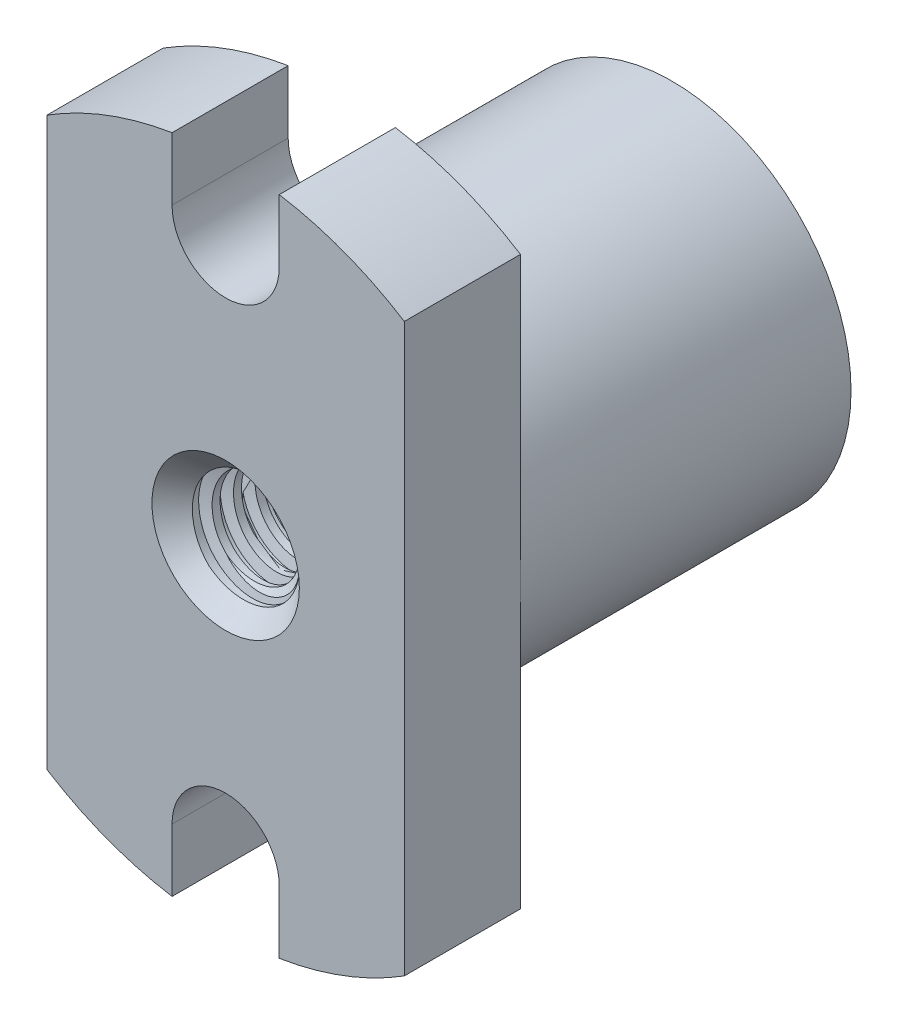
from build123d import *

# Parameters (mm, degrees)
BOSS_EXTRUDE1_START     = -12.7
BOSS_EXTRUDE1_OUTLINE_R = 5.08
BOSS_EXTRUDE1_DEPTH     = 12.7
BOSS_EXTRUDE1_2_DEPTH   = 3.302
SKETCH1_2_R             = 1.5875
BOSS_EXTRUDE2_DEPTH     = 12.7
CUT_SWEEP1_PITCH        = 0.60911271


with BuildPart() as part:
    # Boss-Extrude1: read off the stored shape, not the designer's step
    # Boss-Extrude1 outline → Boss-Extrude1 (new body)
    with BuildSketch(Plane(origin=(0, 0, 67.6840202), x_dir=(-1, 0, 0), z_dir=(0, 0, -1)).offset(BOSS_EXTRUDE1_START)):
        Circle(BOSS_EXTRUDE1_OUTLINE_R)
    extrude(amount=BOSS_EXTRUDE1_DEPTH)

    # Boss-Extrude1 2 outline → Boss-Extrude1 2 (add)
    with BuildSketch(Plane(origin=(0, 0, 67.6840202), x_dir=(-1, 0, 0), z_dir=(0, 0, -1)).offset(BOSS_EXTRUDE1_START)):
        with BuildLine():
            Line((5.08, -8.057246738), (5.08, 0))
            ThreePointArc((5.08, 0), (-4e-09, -5.08), (-5.08, 7e-09))
            Line((-5.08, 7e-09), (-5.08, -8.057246738))
            ThreePointArc((-5.08, -8.057246738), (-3.369790654, -8.908991859), (-1.524, -9.402289562))
            Line((-1.524, -9.402289562), (-1.524, -7.62))
            ThreePointArc((-1.524, -7.62), (0, -6.096), (1.524, -7.62))
            Line((1.524, -7.62), (1.524, -9.402289562))
            ThreePointArc((1.524, -9.402289562), (3.369790654, -8.908991859), (5.08, -8.057246738))
        make_face()
        with BuildLine():
            ThreePointArc((-5.08, 7e-09), (4e-09, 5.08), (5.08, 0))
            Line((5.08, 0), (5.08, 8.057246738))
            ThreePointArc((5.08, 8.057246738), (3.369790654, 8.908991859), (1.524, 9.402289562))
            Line((1.524, 9.402289562), (1.524, 7.62))
            ThreePointArc((1.524, 7.62), (0, 6.096), (-1.524, 7.62))
            Line((-1.524, 7.62), (-1.524, 9.402289562))
            ThreePointArc((-1.524, 9.402289562), (-3.369790654, 8.908991859), (-5.08, 8.057246738))
            Line((-5.08, 8.057246738), (-5.08, 7e-09))
        make_face()
    extrude(amount=BOSS_EXTRUDE1_2_DEPTH)


with BuildPart() as body_2:
    # Sketch1<2> → Boss-Extrude2 (new body)
    with BuildSketch(Plane(origin=(0, 0, 67.6840202), x_dir=(-1, 0, 0), z_dir=(0, 0, -1))):
        Circle(SKETCH1_2_R)
    extrude(amount=-BOSS_EXTRUDE2_DEPTH)

    # Cut-Sweep1: arcs per turn and ends read off the stored shape
    # Cut-Sweep1: the profile of Sketch3 profile screwed along a right-hand helix through 24.456242 turns, 6 arcs to a turn; built about Z, then put on its axis
    cut_sweep1_z = Axis((0, 0, 0), (0, 0, 1))
    cut_sweep1_corners = [(1.5878, 0, -0.609035125), (1.5878, 0, -0.992510279), (1.282943645, 0, -0.913669065), (1.282943645, 0, -0.687876339)]
    with BuildLine(mode=Mode.PRIVATE) as cut_sweep1_profile:
        Line(cut_sweep1_corners[0], cut_sweep1_corners[1])
        Line(cut_sweep1_corners[1], cut_sweep1_corners[2])
        Line(cut_sweep1_corners[2], cut_sweep1_corners[3])
        Line(cut_sweep1_corners[3], cut_sweep1_corners[0])
    cut_sweep1_cap = Face(cut_sweep1_profile.wire())
    cut_sweep1_turn_angles = [0, 30, 60, 90, 120, 150, 180, 210, 240, 270, 300, 330, 360]
    cut_sweep1_turn_weights = [1, 0.8660254037844387, 1, 0.8660254037844387, 1, 0.8660254037844387, 1, 0.8660254037844387, 1, 0.8660254037844387, 1, 0.8660254037844387, 1]
    cut_sweep1_turn_rails = [Edge.make_bspline([Vector(p[0], p[1], 0).rotate(cut_sweep1_z, cut_sweep1_turn_angles[k]) / cut_sweep1_turn_weights[k] + Vector(0, 0, p[2] + CUT_SWEEP1_PITCH * cut_sweep1_turn_angles[k] / 360) for k in range(13)], [0, 0, 0, 1, 1, 2, 2, 3, 3, 4, 4, 5, 5, 6, 6, 6], 2, cut_sweep1_turn_weights) for p in cut_sweep1_corners]
    cut_sweep1_turn_sides = [Face.make_surface_from_curves(cut_sweep1_turn_rails[p[0]], cut_sweep1_turn_rails[p[1]]) for p in [(0, 1), (1, 2), (2, 3), (3, 0)]]
    cut_sweep1_last_angles = [8640, 8670, 8700, 8730, 8760, 8782.1235, 8804.247]
    cut_sweep1_last_weights = [1, 0.8660254037844387, 1, 0.8660254037844387, 1, 0.926374243668776, 1]
    cut_sweep1_last_rails = [Edge.make_bspline([Vector(p[0], p[1], 0).rotate(cut_sweep1_z, cut_sweep1_last_angles[k]) / cut_sweep1_last_weights[k] + Vector(0, 0, p[2] + CUT_SWEEP1_PITCH * cut_sweep1_last_angles[k] / 360) for k in range(7)], [0, 0, 0, 1, 1, 2, 2, 3, 3, 3], 2, cut_sweep1_last_weights) for p in cut_sweep1_corners]
    cut_sweep1_last_sides = [Face.make_surface_from_curves(cut_sweep1_last_rails[p[0]], cut_sweep1_last_rails[p[1]]) for p in [(0, 1), (1, 2), (2, 3), (3, 0)]]
    cut_sweep1 = Plane(origin=(0, 0, 67.6840202), x_dir=(1, 0, 0), z_dir=(0, 0, 1)) * Solid(Shell([*[p.moved(Location((0, 0, CUT_SWEEP1_PITCH * i))) for i in range(24) for p in cut_sweep1_turn_sides], *cut_sweep1_last_sides, cut_sweep1_cap, cut_sweep1_cap.rotate(cut_sweep1_z, 8804.247).moved(Location((0, 0, CUT_SWEEP1_PITCH * 8804.247 / 360)))]))
    add(cut_sweep1, mode=Mode.SUBTRACT)


with BuildPart() as part_1:
    add(part.part)

    # Combine1: cut body 2
    add(body_2.part, mode=Mode.SUBTRACT)

    # Cut-Extrude1 cone 1 section (through the dimple's axis) → Cut-Extrude1 (revolve, cut)
    with BuildSketch(Plane(origin=(0, 0, 67.6840202), x_dir=(0, 1, 0), z_dir=(1, 0, 0))):
        Polygon((0, 0), (2.0955, 0), (0, 2.0955), align=None)
    revolve(axis=Axis((0, 0, 67.6840202), (0, 0, 1)), mode=Mode.SUBTRACT)

    # Cut-Extrude2 cone 1 section (through the dimple's axis) → Cut-Extrude2 (revolve, cut)
    with BuildSketch(Plane(origin=(0, 0, 80.3840202), x_dir=(0, -1, 0), z_dir=(1, 0, 0))):
        Polygon((0, 0), (2.0955, 0), (0, 2.0955), align=None)
    revolve(axis=Axis((0, 0, 80.3840202), (0, 0, -1)), mode=Mode.SUBTRACT)


solid = part_1.part
